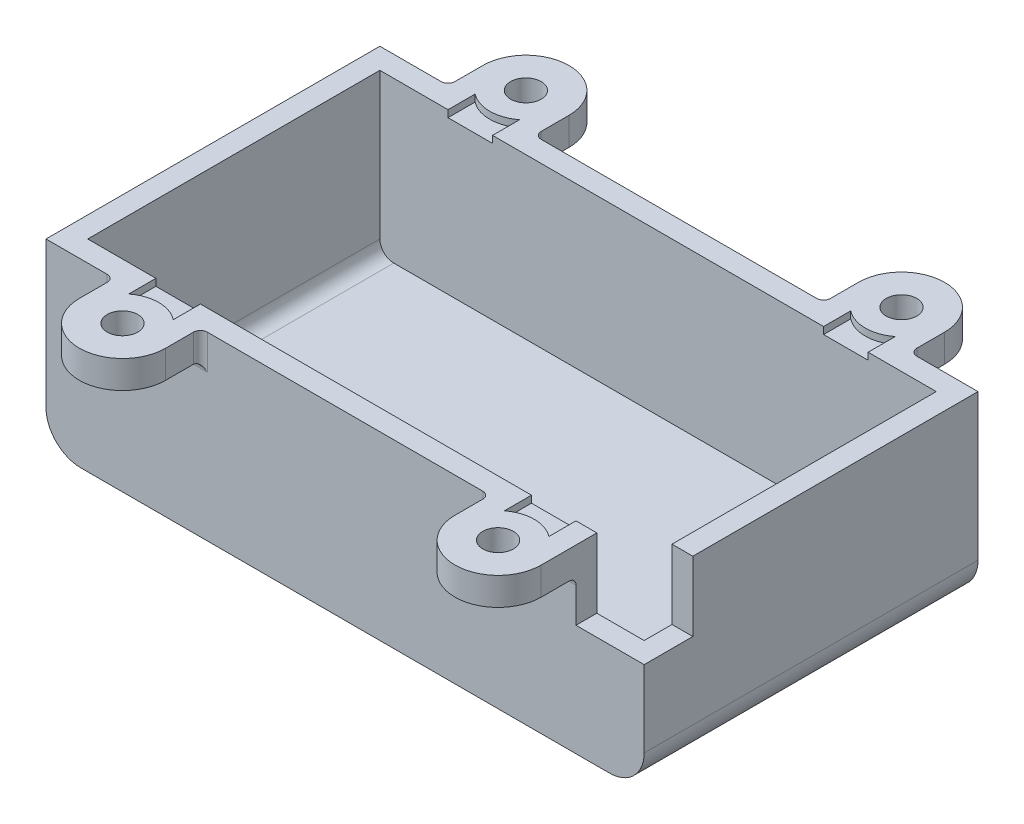
from build123d import *

# Parameters (mm, degrees)
BOSS_EXTRUDE1_DEPTH = 24
SKETCH3_R           = 1.1
BOSS_EXTRUDE6_DEPTH = 2
SHELL1_START        = 2.5
SHELL1_OUTLINE_W    = 40
SHELL1_OUTLINE_H    = 21
SHELL1_DEPTH        = 10.5
SHELL1_START_2      = 12.5
SHELL1_2_DEPTH      = 0.5
SHELL1_START_3      = 1.5
SHELL1_3_DEPTH      = 21
CUT_EXTRUDE1_START  = 16.6
SKETCH5_W           = 3.5
SKETCH5_H           = 5
CUT_EXTRUDE1_DEPTH  = 4.9
FILLET1_R           = 0.5


with BuildPart() as part:
    # Sketch1 → Boss-Extrude1 (new body)
    with BuildSketch(Plane.XY):
        with BuildLine():
            Line((-21.5, 13), (21.5, 13))
            Line((21.5, 13), (21.5, 2.5))
            ThreePointArc((21.5, 2.5), (20.767766953, 0.732233047), (19, 0))
            Line((19, 0), (-19, 0))
            ThreePointArc((-19, 0), (-20.767766953, 0.732233047), (-21.5, 2.5))
            Line((-21.5, 2.5), (-21.5, 13))
        make_face()
    extrude(amount=BOSS_EXTRUDE1_DEPTH)

    # Sketch3 → Boss-Extrude6 (add)
    # profile 1 of 4: a face of its own
    with BuildSketch(Plane(origin=(0, 13, 0), x_dir=(-1, 0, 0), z_dir=(0, 1, 0))):
        with BuildLine():
            Line((16.6, 0), (10.4, 0))
            Line((10.4, 0), (10.4, -2.5))
            ThreePointArc((10.4, -2.5), (13.5, -5.6), (16.6, -2.5))
            Line((16.6, -2.5), (16.6, 0))
        make_face()
        with Locations(Location((13.5, -2.5, 0), (0, 0, 90))):
            Circle(SKETCH3_R, mode=Mode.SUBTRACT)
    # profile 2 of 4: a face of its own
    with BuildSketch(Plane(origin=(0, 13, 0), x_dir=(-1, 0, 0), z_dir=(0, 1, 0))):
        with BuildLine():
            Line((-10.4, 0), (-16.6, 0))
            Line((-16.6, 0), (-16.6, -2.5))
            ThreePointArc((-16.6, -2.5), (-13.5, -5.6), (-10.4, -2.5))
            Line((-10.4, -2.5), (-10.4, 0))
        make_face()
        with Locations(Location((-13.5, -2.5, 0), (0, 0, 90))):
            Circle(SKETCH3_R, mode=Mode.SUBTRACT)
    # profile 3 of 4: a face of its own
    with BuildSketch(Plane(origin=(0, 13, 0), x_dir=(-1, 0, 0), z_dir=(0, 1, 0))):
        with BuildLine():
            Line((-16.6, 26.5), (-16.6, 24))
            Line((-16.6, 24), (-10.4, 24))
            Line((-10.4, 24), (-10.4, 26.5))
            ThreePointArc((-10.4, 26.5), (-13.5, 29.6), (-16.6, 26.5))
        make_face()
        with Locations(Location((-13.5, 26.5, 0), (0, 0, 90))):
            Circle(SKETCH3_R, mode=Mode.SUBTRACT)
    # profile 4 of 4: a face of its own
    with BuildSketch(Plane(origin=(0, 13, 0), x_dir=(-1, 0, 0), z_dir=(0, 1, 0))):
        with BuildLine():
            Line((10.4, 26.5), (10.4, 24))
            Line((10.4, 24), (16.6, 24))
            Line((16.6, 24), (16.6, 26.5))
            ThreePointArc((16.6, 26.5), (13.5, 29.6), (10.4, 26.5))
        make_face()
        with Locations(Location((13.5, 26.5, 0), (0, 0, 90))):
            Circle(SKETCH3_R, mode=Mode.SUBTRACT)
    extrude(amount=-BOSS_EXTRUDE6_DEPTH)

    # Shell1: read off the stored shape, not the designer's step
    # Shell1 outline → Shell1 (cut)
    with BuildSketch(Plane(origin=(0, 0, 0), x_dir=(1, 0, 0), z_dir=(0, 1, 0)).offset(SHELL1_START)):
        with Locations((0, -12)):
            Rectangle(SHELL1_OUTLINE_W, SHELL1_OUTLINE_H)
    extrude(amount=SHELL1_DEPTH, mode=Mode.SUBTRACT)

    # Shell1 2 outline → Shell1 2 (cut)
    with BuildSketch(Plane(origin=(0, 0, 0), x_dir=(1, 0, 0), z_dir=(0, 1, 0)).offset(SHELL1_START_2)):
        with BuildLine():
            Line((-15.1, 0.450609847), (-15.1, -1.5))
            Line((-15.1, -1.5), (-11.9, -1.5))
            Line((-11.9, -1.5), (-11.9, 0.450609847))
            ThreePointArc((-11.9, 0.450609847), (-13.5, -0.1), (-15.1, 0.450609847))
        make_face()
        with BuildLine():
            Line((-11.9, -22.5), (-15.1, -22.5))
            Line((-15.1, -22.5), (-15.1, -24.450609847))
            ThreePointArc((-15.1, -24.450609847), (-13.5, -23.9), (-11.9, -24.450609847))
            Line((-11.9, -24.450609847), (-11.9, -22.5))
        make_face()
        with BuildLine():
            Line((11.9, 0.450609847), (11.9, -1.5))
            Line((11.9, -1.5), (15.1, -1.5))
            Line((15.1, -1.5), (15.1, 0.450609847))
            ThreePointArc((15.1, 0.450609847), (13.5, -0.1), (11.9, 0.450609847))
        make_face()
        with BuildLine():
            Line((15.1, -22.5), (11.9, -22.5))
            Line((11.9, -22.5), (11.9, -24.450609847))
            ThreePointArc((11.9, -24.450609847), (13.5, -23.9), (15.1, -24.450609847))
            Line((15.1, -24.450609847), (15.1, -22.5))
        make_face()
    extrude(amount=SHELL1_2_DEPTH, mode=Mode.SUBTRACT)

    # Shell1 3 outline → Shell1 3 (cut)
    with BuildSketch(Plane.XY.offset(SHELL1_START_3)):
        with BuildLine():
            ThreePointArc((19, 1.5), (19.707106781, 1.792893219), (20, 2.5))
            Line((20, 2.5), (-20, 2.5))
            ThreePointArc((-20, 2.5), (-19.707106781, 1.792893219), (-19, 1.5))
            Line((-19, 1.5), (19, 1.5))
        make_face()
    extrude(amount=SHELL1_3_DEPTH, mode=Mode.SUBTRACT)

    # Sketch5 → Cut-Extrude1 (cut)
    with BuildSketch(Plane(origin=(0, 0, 0), x_dir=(0, 0, -1), z_dir=(1, 0, 0)).offset(CUT_EXTRUDE1_START)):
        with Locations((-22.25, 10.5)):
            Rectangle(SKETCH5_W, SKETCH5_H)
    extrude(amount=CUT_EXTRUDE1_DEPTH, mode=Mode.SUBTRACT)

    # Fillet1
    fillet1_edges = [part.edges().sort_by_distance(p)[0] for p in [
        (-10.4, 12, 24),
        (-16.6, 12, 24),
        (10.4, 12, 24),
        (10.4, 12, 0),
        (16.6, 12, 0),
        (-10.4, 12, 0),
        (-16.6, 12, 0),
        (13.5, 11, 0),
        (-13.5, 11, 0),
        (13.5, 11, 24),
        (-13.5, 11, 24),
    ]]
    fillet(fillet1_edges, radius=FILLET1_R)


solid = part.part
